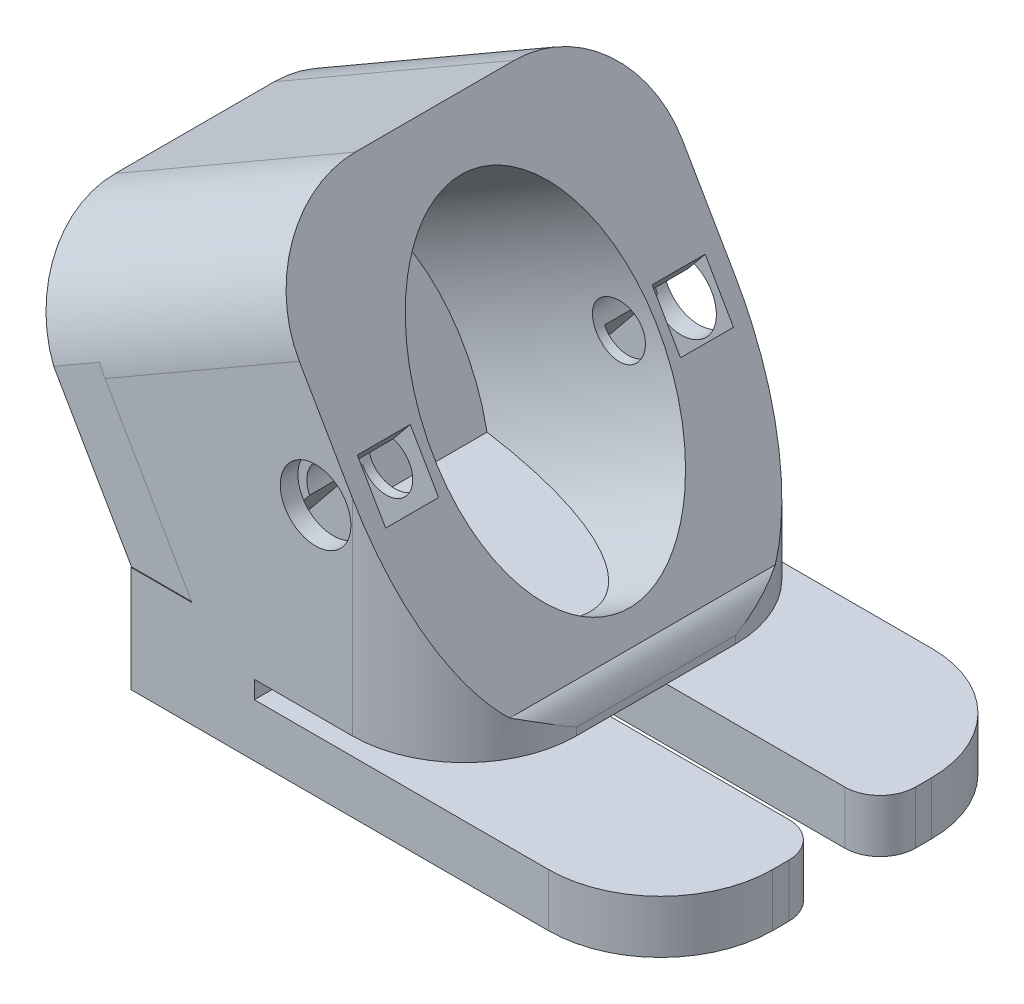
from build123d import *

# Parameters (mm, degrees)
SKETCH2_W           = 21.7
SKETCH2_H           = 25.05
SKETCH2_RX          = 9.525
SKETCH2_RY          = 6.35
BOSS_EXTRUDE1_DEPTH = 12.7
SKETCH3_W           = 21.660653916
SKETCH3_H           = 25.05
BOSS_EXTRUDE2_DEPTH = 3
SKETCH5_W           = 18.892037138
SKETCH5_H           = 21.7
BOSS_EXTRUDE3_DEPTH = 2
SKETCH6_W           = 30
SKETCH6_H           = 21.7
BOSS_EXTRUDE4_DEPTH = 4
SKETCH7_W           = 21.7
SKETCH7_H           = 1
SKETCH7_W_2         = 3.175
SKETCH7_H_2         = 3
CUT_EXTRUDE2_DEPTH  = 23
SKETCH7_3_W         = 21.7
SKETCH7_3_H         = 7.272473706
CUT_EXTRUDE3_DEPTH  = 44.803879418
SKETCH11_R          = 1
CUT_EXTRUDE8_DEPTH  = 33.487034031
SKETCH15_W          = 3
SKETCH15_H          = 3
CUT_EXTRUDE9_DEPTH  = 28.443249292
CUT_EXTRUDE4_REACH  = 47.088
SKETCH9_R           = 1.5
SKETCH10_R          = 2
CUT_EXTRUDE7_DEPTH  = 1
FILLET5_R           = 6.35
FILLET6_R           = 2
FILLET7_R           = 2


with BuildPart() as part:
    # Sketch2 → Boss-Extrude1 (new body)
    with BuildSketch(Plane(origin=(16.497783942, 9.525, 0), x_dir=(0, 0, -1), z_dir=(0.8660254037844379, 0.5000000000000013, 0))):
        Rectangle(SKETCH2_W, SKETCH2_H)
        with Locations(Location((0, 0), (0, 0, 90))):
            Ellipse(SKETCH2_RX, SKETCH2_RY, mode=Mode.SUBTRACT)
    extrude(amount=-BOSS_EXTRUDE1_DEPTH)

    # Sketch3 → Boss-Extrude2 (add)
    with BuildSketch(Plane(origin=(5.499261314, 3.175, 0), x_dir=(0, 0, 1), z_dir=(-0.8660254037844379, -0.5000000000000014, 0))):
        with Locations((-0.019673042, 0)):
            Rectangle(SKETCH3_W, SKETCH3_H)
    extrude(amount=BOSS_EXTRUDE2_DEPTH)

    # Sketch5 → Boss-Extrude3 (add)
    with BuildSketch(Plane(origin=(0, 0, 0), x_dir=(-1, 0, 0), z_dir=(0, 1, 0))):
        with Locations((-13.314265373, 0)):
            Rectangle(SKETCH5_W, SKETCH5_H)
    extrude(amount=-BOSS_EXTRUDE3_DEPTH)

    # Sketch6 → Boss-Extrude4 (add)
    with BuildSketch(Plane.XZ.offset(2)):
        with Locations((18.868246804, 0)):
            Rectangle(SKETCH6_W, SKETCH6_H)
    extrude(amount=BOSS_EXTRUDE4_DEPTH)

    # Sketch7 → Cut-Extrude2 (cut)
    with BuildSketch(Plane(origin=(33.868246804, 0, 0), x_dir=(0, 0, -1), z_dir=(1, 0, 0))):
        with Locations((0, -2.5)):
            Rectangle(SKETCH7_W, SKETCH7_H)
        with Locations((0, -4.5)):
            Rectangle(SKETCH7_W_2, SKETCH7_H_2)
    extrude(amount=-CUT_EXTRUDE2_DEPTH, mode=Mode.SUBTRACT)

    # Sketch7<3> → Cut-Extrude3 (cut, through all)
    with BuildSketch(Plane(origin=(33.868246804, 0, 0), x_dir=(0, 0, -1), z_dir=(1, 0, 0))):
        with Locations((0, -9.636236853)):
            Rectangle(SKETCH7_3_W, SKETCH7_3_H)
    extrude(amount=-CUT_EXTRUDE3_DEPTH, mode=Mode.SUBTRACT)

    # Sketch11 → Cut-Extrude8 (cut, through all)
    with BuildSketch(Plane(origin=(19.672783942, 0.194872981, 0), x_dir=(0, 0, -1), z_dir=(-1, 0, 0))):
        with Locations(Location((0, -3.830865705, 0), (0, 0, 90))):
            Circle(SKETCH11_R)
    extrude(amount=CUT_EXTRUDE8_DEPTH, mode=Mode.SUBTRACT)

    # Sketch15 → Cut-Extrude9 (cut, symmetric)
    with BuildSketch(Plane(origin=(16.497783942, 9.525, 0), x_dir=(0.7757354378747654, -0.6310582623064579, 0), z_dir=(0.6310582623064579, 0.7757354378747654, 0))):
        with Locations((0, -8.35)):
            Rectangle(SKETCH15_W, SKETCH15_H)
    cut_extrude9 = extrude(amount=CUT_EXTRUDE9_DEPTH, both=True, mode=Mode.SUBTRACT)

    # Sketch9 → Cut-Extrude4 (cut, up to next)
    with BuildSketch(Plane(origin=(0, 0, -10.85), x_dir=(-1, 0, 0), z_dir=(0, 0, -1)), mode=Mode.PRIVATE) as cut_extrude4_sk1:
        with Locations((-14.332720433, 8.275)):
            Circle(SKETCH9_R)
    cut_extrude4_tool1 = extrude(cut_extrude4_sk1.sketch, amount=-CUT_EXTRUDE4_REACH, mode=Mode.PRIVATE) & part.part
    cut_extrude4 = cut_extrude4_tool1.solids().sort_by_distance((14.33272, 8.275, -10.85))[0]
    add(cut_extrude4, mode=Mode.SUBTRACT)

    # Sketch10 → Cut-Extrude7 (cut)
    with BuildSketch(Plane(origin=(0, 0, -10.85), x_dir=(-1, 0, 0), z_dir=(0, 0, -1))):
        with Locations((-14.332720433, 8.275)):
            Circle(SKETCH10_R)
    cut_extrude7 = extrude(amount=-CUT_EXTRUDE7_DEPTH, mode=Mode.SUBTRACT)

    # Mirror1: Cut-Extrude9, Cut-Extrude4, Cut-Extrude7 across plane
    add(cut_extrude9.mirror(Plane.XY), mode=Mode.SUBTRACT)
    add(cut_extrude4.mirror(Plane.XY), mode=Mode.SUBTRACT)
    add(cut_extrude7.mirror(Plane.XY), mode=Mode.SUBTRACT)

    # Fillet5
    fillet5_edges = [part.edges().sort_by_distance(p)[0] for p in [
        (33.868246804, -4.5, 10.85),
        (33.868246804, -4.5, -10.85),
        (22.760283942, -1, -10.85),
        (22.760283942, -1, 10.85),
        (4.736022628, 17.196968182, 10.85),
        (3.436984522, 16.446968182, -10.85),
    ]]
    fillet(fillet5_edges, radius=FILLET5_R)

    # Fillet6
    fillet6_edges = [part.edges().sort_by_distance(p)[0] for p in [
        (33.868246804, -4.5, 1.5875),
        (33.868246804, -4.5, -1.5875),
    ]]
    fillet(fillet6_edges, radius=FILLET6_R)

    # Fillet7
    # the kernel refuses this fillet: 2 mm, written as the material it takes off along each edge
    with BuildSketch(Plane(origin=(22.760283942, 0, 8.429393602), x_dir=(-1, 0, 0), z_dir=(0, 0, -1))) as fillet7_piece_1:
        with BuildLine():
            CenterArc((2, -1.571757441), FILLET7_R, 128.197977663, 51.802022337)
            Line((0, -1.571757441), (-0.04, -1.571757441))
            Line((-0.04, -1.571757441), (-0.04, 0))
            Line((-0.04, 0), (0, 0.04))
            ThreePointArc((0, 0.04), (0.381619343, 0.04), (0.73850346, 0.031435149))
            Line((0.73850346, 0.031435149), (0.763238686, 0))
        make_face()
    extrude(amount=16.858787203, mode=Mode.SUBTRACT)


solid = part.part
